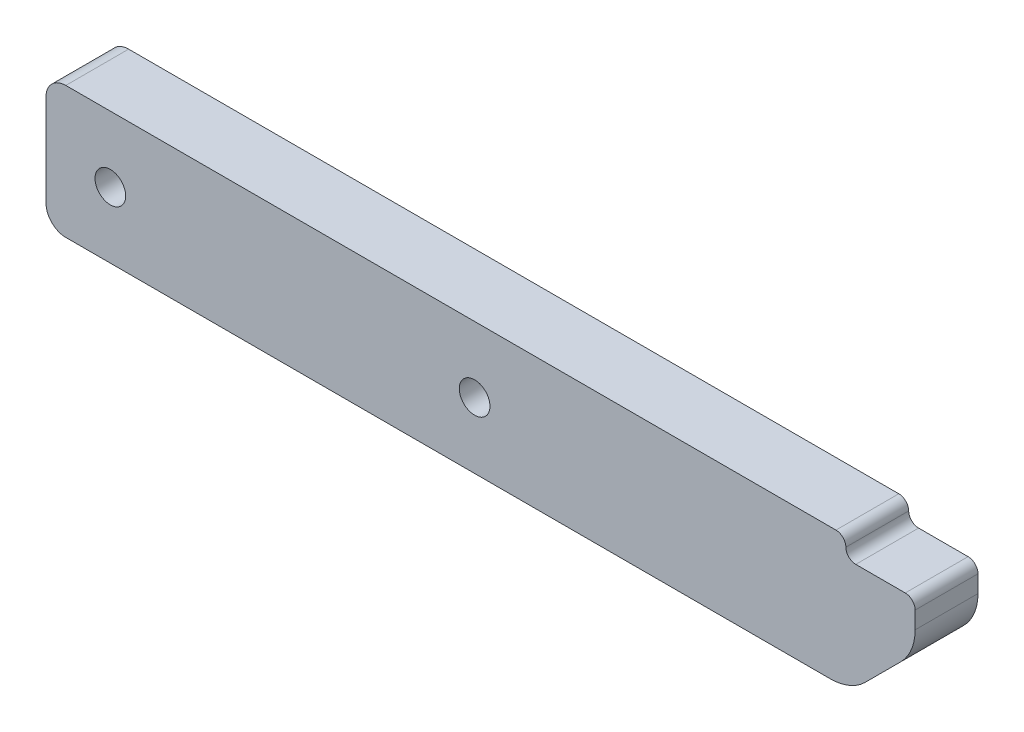
from build123d import *

# Parameters (mm, degrees)
SKETCH1_W           = 13.3
SKETCH1_H           = 13.3
SKETCH1_R           = 1.55
SKETCH1_W_2         = 74.5
BOSS_EXTRUDE1_DEPTH = 6.35
FILLET2_R           = 2
CHAMFER1_SIZE       = 6.5
FILLET3_R           = 5
SKETCH2_W           = 7
SKETCH2_H           = 2
CUT_EXTRUDE1_DEPTH  = 53.609742444
FILLET4_R           = 1


with BuildPart() as part:
    # Sketch1 → Boss-Extrude1 (new body)
    # profile 1 of 2: a face of its own
    with BuildSketch(Plane.XY):
        with Locations((-45.15, 0)):
            Rectangle(SKETCH1_W, SKETCH1_H)
        with Locations((-45.3, 0)):
            Circle(SKETCH1_R, mode=Mode.SUBTRACT)
    # profile 2 of 2: a face of its own
    with BuildSketch(Plane.XY):
        with Locations((-1.25, 0)):
            Rectangle(SKETCH1_W_2, SKETCH1_H)
        with Locations((-8.5, 0)):
            Circle(SKETCH1_R, mode=Mode.SUBTRACT)
    extrude(amount=BOSS_EXTRUDE1_DEPTH)

    # Fillet2
    fillet2_edges = [part.edges().sort_by_distance(p)[0] for p in [
        (36, 6.65, 3.175),
        (-51.8, -6.65, 3.175),
        (-51.8, 6.65, 3.175),
    ]]
    fillet(fillet2_edges, radius=FILLET2_R)

    # Chamfer1
    chamfer1_edges = [part.edges().sort_by_distance(p)[0] for p in [
        (36, -6.65, 3.175),
    ]]
    chamfer(chamfer1_edges, length=CHAMFER1_SIZE)

    # Fillet3
    fillet3_edges = [part.edges().sort_by_distance(p)[0] for p in [
        (36, -0.15, 3.175),
        (29.5, -6.65, 3.175),
    ]]
    fillet(fillet3_edges, radius=FILLET3_R)

    # Sketch2 → Cut-Extrude1 (cut, through all)
    with BuildSketch(Plane.XY.offset(6.35)):
        with Locations((32.5, 5.65)):
            Rectangle(SKETCH2_W, SKETCH2_H)
    extrude(amount=-CUT_EXTRUDE1_DEPTH, mode=Mode.SUBTRACT)

    # Fillet4
    fillet4_edges = [part.edges().sort_by_distance(p)[0] for p in [
        (29, 6.65, 3.175),
        (29, 4.65, 3.175),
        (36, 4.65, 3.175),
    ]]
    fillet(fillet4_edges, radius=FILLET4_R - 0.0001)  # a hair under: the kernel refuses the full size


solid = part.part
